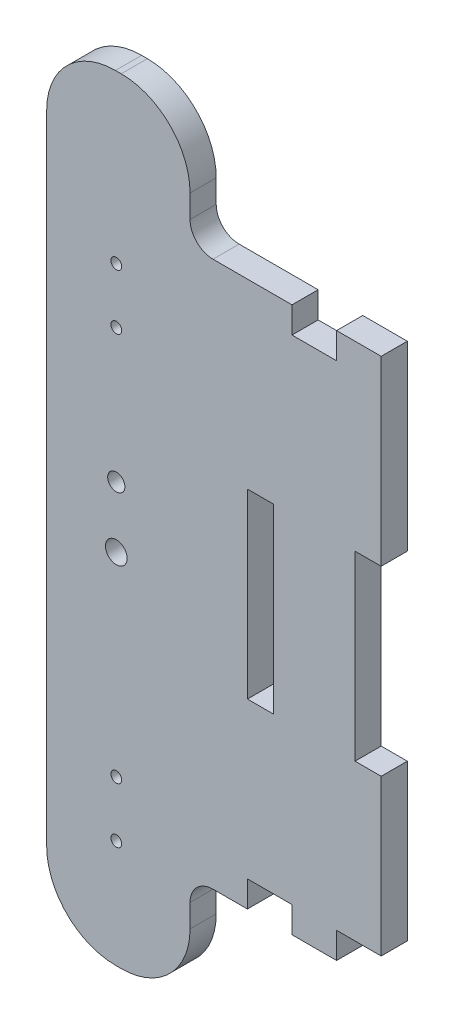
from build123d import *

# Parameters (mm, degrees)
SKETCH1_W           = 29.6164
SKETCH1_H           = 120.8024
BOSS_EXTRUDE1_DEPTH = 5.7912
SKETCH3_W           = 5.7912
SKETCH3_H           = 40.267466666
CUT_EXTRUDE2_DEPTH  = 63.458992516
SKETCH6_W           = 9.872133334
SKETCH6_H           = 5.7912
CUT_EXTRUDE5_DEPTH  = 63.458992516
SKETCH9_W           = 5.7912
SKETCH9_H           = 120.8024
BOSS_EXTRUDE3_DEPTH = 44.45
SKETCH13_W          = 31.75
SKETCH13_H          = 5.7912
BOSS_EXTRUDE4_DEPTH = 25.4
SKETCH14_W          = 31.75
SKETCH14_H          = 5.7912
BOSS_EXTRUDE5_DEPTH = 25.4
SKETCH16_R          = 2.4003
SKETCH16_R_2        = 1.905
CUT_EXTRUDE8_DEPTH  = 13.462
SKETCH18_R          = 1.1938
CUT_EXTRUDE9_DEPTH  = 105.436191936
FILLET2_R           = 15.24
FILLET3_R           = 5.08
CAVITY1_START       = -14.8082
CAVITY1_OUTLINE_W   = 5.7912
CAVITY1_OUTLINE_H   = 5.7912
CAVITY1_DEPTH       = 9.872133333
CAVITY1_START_2     = 4.936066667
CAVITY1_2_OUTLINE_W = 5.7912
CAVITY1_2_OUTLINE_H = 5.7912
CAVITY1_2_DEPTH     = 9.872133333


# Read off the part's stored shape, not the designer's step: Cavity1
with BuildPart() as part:
    # Sketch1 → Boss-Extrude1 (new body)
    with BuildSketch(Plane.XY):
        Rectangle(SKETCH1_W, SKETCH1_H)
    extrude(amount=BOSS_EXTRUDE1_DEPTH)

    # Sketch3 → Cut-Extrude2 (cut, through all)
    with BuildSketch(Plane(origin=(0, 0, 0), x_dir=(-1, 0, 0), z_dir=(0, 0, -1))):
        with Locations((-11.9126, 0)):
            Rectangle(SKETCH3_W, SKETCH3_H)
        with Locations((11.9126, 0)):
            Rectangle(SKETCH3_W, SKETCH3_H)
    extrude(amount=-CUT_EXTRUDE2_DEPTH, mode=Mode.SUBTRACT)

    # Sketch6 → Cut-Extrude5 (cut, through all)
    with BuildSketch(Plane(origin=(0, 0, 0), x_dir=(-1, 0, 0), z_dir=(0, 0, -1))):
        with Locations((0, 57.5056)):
            Rectangle(SKETCH6_W, SKETCH6_H)
    extrude(amount=-CUT_EXTRUDE5_DEPTH, mode=Mode.SUBTRACT)

    # Sketch9 → Boss-Extrude3 (add)
    with BuildSketch(Plane.ZY.offset(14.8082)):
        with Locations((2.8956, 0)):
            Rectangle(SKETCH9_W, SKETCH9_H)
    extrude(amount=BOSS_EXTRUDE3_DEPTH)

    # Sketch13 → Boss-Extrude4 (add)
    with BuildSketch(Plane.XZ.offset(60.4012)):
        with Locations((-43.3832, 2.8956)):
            Rectangle(SKETCH13_W, SKETCH13_H)
    extrude(amount=BOSS_EXTRUDE4_DEPTH)

    # Sketch14 → Boss-Extrude5 (add)
    with BuildSketch(Plane(origin=(0, 60.4012, 0), x_dir=(1, 0, 0), z_dir=(0, 1, 0))):
        with Locations((-43.3832, -2.8956)):
            Rectangle(SKETCH14_W, SKETCH14_H)
    extrude(amount=BOSS_EXTRUDE5_DEPTH)

    # Sketch16 → Cut-Extrude8 (cut)
    with BuildSketch(Plane.XY):
        with Locations(Location((-43.842108599, -6.4897, 0), (0, 0, 180))):
            Circle(SKETCH16_R)
        with Locations(Location((-43.842108599, 6.985, 0), (0, 0, 180))):
            Circle(SKETCH16_R_2)
    extrude(amount=CUT_EXTRUDE8_DEPTH, mode=Mode.SUBTRACT)

    # Sketch18 → Cut-Extrude9 (cut, through all)
    with BuildSketch(Plane(origin=(0, 0, 0), x_dir=(-1, 0, 0), z_dir=(0, 0, -1))):
        with Locations((43.842108599, 48.8696)):
            Circle(SKETCH18_R)
        with Locations((43.842108599, 36.6014)):
            Circle(SKETCH18_R)
        with Locations((43.842108599, -49.5808)):
            Circle(SKETCH18_R)
        with Locations((43.842108599, -61.849)):
            Circle(SKETCH18_R)
    extrude(amount=-CUT_EXTRUDE9_DEPTH, mode=Mode.SUBTRACT)

    # Fillet2
    fillet2_edges = [part.edges().sort_by_distance(p)[0] for p in [
        (-27.5082, 85.8012, 2.8956),
        (-27.5082, -85.8012, 2.8956),
        (-59.2582, 85.8012, 2.8956),
        (-59.2582, -85.8012, 2.8956),
    ]]
    fillet(fillet2_edges, radius=FILLET2_R)

    # Fillet3
    fillet3_edges = [part.edges().sort_by_distance(p)[0] for p in [
        (-27.5082, -60.4012, 2.8956),
        (-27.5082, 60.4012, 2.8956),
    ]]
    fillet(fillet3_edges, radius=FILLET3_R)

    # Cavity1 outline → Cavity1 (cut)
    with BuildSketch(Plane.YZ.offset(CAVITY1_START)):
        with Locations((-57.5056, 2.8956)):
            Rectangle(CAVITY1_OUTLINE_W, CAVITY1_OUTLINE_H)
    extrude(amount=CAVITY1_DEPTH, mode=Mode.SUBTRACT)

    # Cavity1 2 outline → Cavity1 2 (cut)
    with BuildSketch(Plane.YZ.offset(CAVITY1_START_2)):
        with Locations((-57.5056, 2.8956)):
            Rectangle(CAVITY1_2_OUTLINE_W, CAVITY1_2_OUTLINE_H)
    extrude(amount=CAVITY1_2_DEPTH, mode=Mode.SUBTRACT)


solid = part.part
